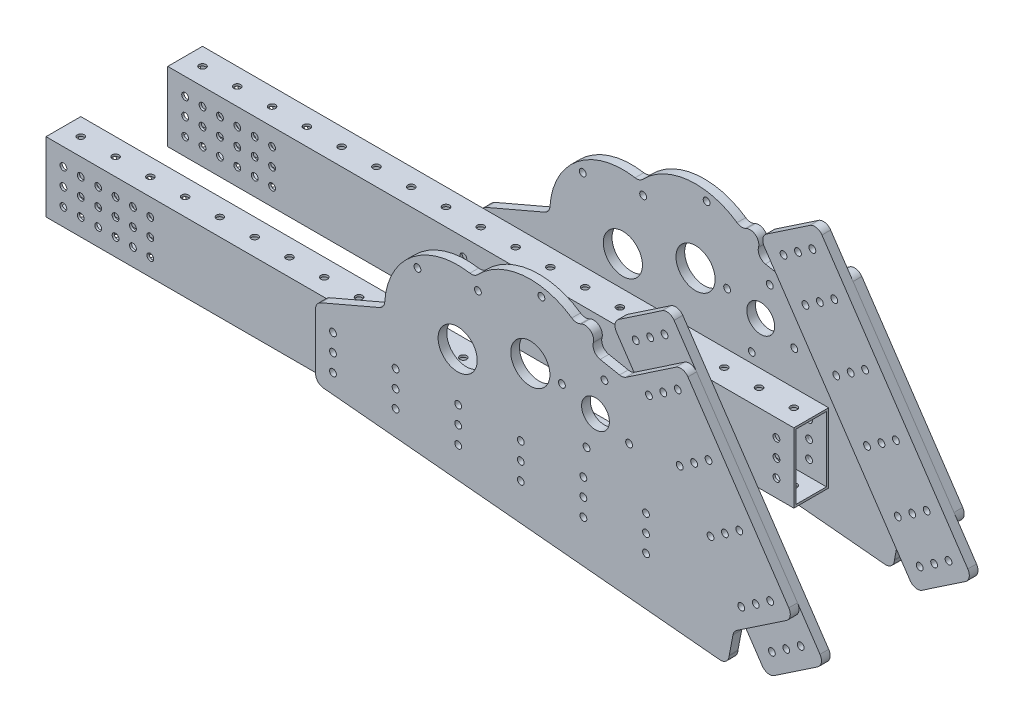
from build123d import *

# Parameters (mm, degrees)
BEARING_BLOCK_INTERFACE_PLATE_R = 2.4892
BOSS_EXTRUDE1_DEPTH             = 6.35
FILLET2_R                       = 6.35
PLATE_GB_R                      = 2.4892
PLATE_GB_R_2                    = 14.2875
PLATE_GB_R_3                    = 10.16
BOSS_EXTRUDE2_DEPTH             = 6.35
FILLET1_R                       = 6.35
TUBE_W                          = 457.2
TUBE_H                          = 50.8
BOSS_EXTRUDE3_DEPTH             = 25.4
SHELL2_T                        = -1.5875
SKETCH11_R                      = 2.4892
CUT_EXTRUDE4_DEPTH              = 696.020271071
TUBE_4_R                        = 2.4892
CUT_EXTRUDE2_DEPTH              = 773.869762832
SKETCH10_R                      = 2.4892
CUT_EXTRUDE3_DEPTH              = 774.104503156


with BuildPart() as part:
    # bearing block interface plate → Boss-Extrude1 (new body)
    with BuildSketch(Plane.XY.offset(57.15)):
        Polygon((529.051437766, 336.148394668), (571.166546451, 364.555394164), (684.794544436, 196.094959421), (642.679435751, 167.687959925), align=None)
        with Locations((646.106463048, 185.31848697)):
            Circle(BEARING_BLOCK_INTERFACE_PLATE_R, mode=Mode.SUBTRACT)
        with Locations((656.635240219, 192.420236844)):
            Circle(BEARING_BLOCK_INTERFACE_PLATE_R, mode=Mode.SUBTRACT)
        with Locations((667.164017391, 199.521986718)):
            Circle(BEARING_BLOCK_INTERFACE_PLATE_R, mode=Mode.SUBTRACT)
        with Locations((567.739519154, 346.924867119)):
            Circle(BEARING_BLOCK_INTERFACE_PLATE_R, mode=Mode.SUBTRACT)
        with Locations((557.210741982, 339.823117245)):
            Circle(BEARING_BLOCK_INTERFACE_PLATE_R, mode=Mode.SUBTRACT)
        with Locations((546.681964811, 332.721367371)):
            Circle(BEARING_BLOCK_INTERFACE_PLATE_R, mode=Mode.SUBTRACT)
        with Locations((562.660902028, 309.031618735)):
            Circle(BEARING_BLOCK_INTERFACE_PLATE_R, mode=Mode.SUBTRACT)
        with Locations((573.189679199, 316.133368609)):
            Circle(BEARING_BLOCK_INTERFACE_PLATE_R, mode=Mode.SUBTRACT)
        with Locations((583.71845637, 323.235118483)):
            Circle(BEARING_BLOCK_INTERFACE_PLATE_R, mode=Mode.SUBTRACT)
        with Locations((606.207330972, 289.893990773)):
            Circle(BEARING_BLOCK_INTERFACE_PLATE_R, mode=Mode.SUBTRACT)
        with Locations((595.6785538, 282.792240899)):
            Circle(BEARING_BLOCK_INTERFACE_PLATE_R, mode=Mode.SUBTRACT)
        with Locations((585.149776629, 275.690491025)):
            Circle(BEARING_BLOCK_INTERFACE_PLATE_R, mode=Mode.SUBTRACT)
        with Locations((628.696205573, 256.552863064)):
            Circle(BEARING_BLOCK_INTERFACE_PLATE_R, mode=Mode.SUBTRACT)
        with Locations((618.167428402, 249.45111319)):
            Circle(BEARING_BLOCK_INTERFACE_PLATE_R, mode=Mode.SUBTRACT)
        with Locations((607.63865123, 242.349363316)):
            Circle(BEARING_BLOCK_INTERFACE_PLATE_R, mode=Mode.SUBTRACT)
        with Locations((651.185080174, 223.211735354)):
            Circle(BEARING_BLOCK_INTERFACE_PLATE_R, mode=Mode.SUBTRACT)
        with Locations((640.656303003, 216.10998548)):
            Circle(BEARING_BLOCK_INTERFACE_PLATE_R, mode=Mode.SUBTRACT)
        with Locations((630.127525831, 209.008235606)):
            Circle(BEARING_BLOCK_INTERFACE_PLATE_R, mode=Mode.SUBTRACT)
    extrude(amount=-BOSS_EXTRUDE1_DEPTH)

    # Fillet2
    fillet2_edges = [part.edges().sort_by_distance(p)[0] for p in [
        (642.679435751, 167.687959925, 53.975),
        (571.166546451, 364.555394164, 53.975),
        (529.051437766, 336.148394668, 53.975),
        (684.794544436, 196.094959421, 53.975),
    ]]
    fillet(fillet2_edges, radius=FILLET2_R)


with BuildPart() as body_2:
    # plate+gb → Boss-Extrude2 (new body)
    with BuildSketch(Plane.XY.offset(63.5)):
        with BuildLine():
            Line((319.237342332, 246.126), (319.237342332, 195.326))
            Line((319.237342332, 195.326), (627.129512771, 166.477179286))
            ThreePointArc((627.129512771, 166.477179286), (622.555505171, 169.035259751), (621.371649855, 174.140532299))
            Line((621.371649855, 174.140532299), (623.889276442, 187.327918834))
            Line((623.889276442, 187.327918834), (624.075421765, 188.302952357))
            ThreePointArc((624.075421765, 188.302952357), (625.011743382, 190.608109349), (626.761896857, 192.376557749))
            Line((626.761896857, 192.376557749), (668.371747852, 220.44275663))
            Line((668.371747852, 220.44275663), (587.589343035, 340.207596955))
            Line((587.589343035, 340.207596955), (545.979492039, 312.141398074))
            ThreePointArc((545.979492039, 312.141398074), (543.684196204, 311.18115646), (541.196139608, 311.176541181))
            Line((541.196139608, 311.176541181), (540.222373002, 311.36920423))
            Line((540.222373002, 311.36920423), (527.052121603, 313.974983453))
            ThreePointArc((527.052121603, 313.974983453), (522.79804256, 316.926147758), (522.065562756, 322.05157775))
            ThreePointArc((522.065562756, 322.05157775), (520.117459336, 328.526714762), (513.437327672, 329.574735381))
            Line((513.437327672, 329.574735381), (509.130838224, 327.724214652))
            ThreePointArc((509.130838224, 327.724214652), (470.697933856, 338.939139441), (435.288517283, 320.256637088))
            ThreePointArc((435.288517283, 320.256637088), (389.695116812, 310.014081601), (369.664819812, 267.794947177))
            Line((369.664819812, 267.794947177), (319.237342332, 246.126))
        make_face()
        with Locations((630.127525831, 209.008235606)):
            Circle(PLATE_GB_R, mode=Mode.SUBTRACT)
        with Locations((517.084105797, 253.341484012)):
            Circle(PLATE_GB_R, mode=Mode.SUBTRACT)
        with Locations((640.656303003, 216.10998548)):
            Circle(PLATE_GB_R, mode=Mode.SUBTRACT)
        with Locations((651.185080174, 223.211735354)):
            Circle(PLATE_GB_R, mode=Mode.SUBTRACT)
        with Locations((607.63865123, 242.349363316)):
            Circle(PLATE_GB_R, mode=Mode.SUBTRACT)
        with Locations((618.167428402, 249.45111319)):
            Circle(PLATE_GB_R, mode=Mode.SUBTRACT)
        with Locations((423.001921395, 268.351)):
            Circle(PLATE_GB_R_2, mode=Mode.SUBTRACT)
        with Locations((476.064764939, 285.869819452)):
            Circle(PLATE_GB_R_2, mode=Mode.SUBTRACT)
        with Locations((393.660212596, 305.054190934)):
            Circle(PLATE_GB_R, mode=Mode.SUBTRACT)
        with Locations((437.784787317, 312.695671772)):
            Circle(PLATE_GB_R, mode=Mode.SUBTRACT)
        with Locations((484.156986664, 332.157788165)):
            Circle(PLATE_GB_R, mode=Mode.SUBTRACT)
        with Locations((548.192625531, 271.301996254)):
            Circle(PLATE_GB_R, mode=Mode.SUBTRACT)
        with Locations((499.123593555, 284.450003746)):
            Circle(PLATE_GB_R, mode=Mode.SUBTRACT)
        with Locations((523.658109543, 277.876)):
            Circle(PLATE_GB_R_3, mode=Mode.SUBTRACT)
        with Locations((628.696205573, 256.552863064)):
            Circle(PLATE_GB_R, mode=Mode.SUBTRACT)
        with Locations((585.149776629, 275.690491025)):
            Circle(PLATE_GB_R, mode=Mode.SUBTRACT)
        with Locations((595.6785538, 282.792240899)):
            Circle(PLATE_GB_R, mode=Mode.SUBTRACT)
        with Locations((606.207330972, 289.893990773)):
            Circle(PLATE_GB_R, mode=Mode.SUBTRACT)
        with Locations((530.232113289, 302.410515988)):
            Circle(PLATE_GB_R, mode=Mode.SUBTRACT)
        with Locations((562.660902028, 309.031618735)):
            Circle(PLATE_GB_R, mode=Mode.SUBTRACT)
        with Locations((573.189679199, 316.133368609)):
            Circle(PLATE_GB_R, mode=Mode.SUBTRACT)
        with Locations((583.71845637, 323.235118483)):
            Circle(PLATE_GB_R, mode=Mode.SUBTRACT)
    extrude(amount=-BOSS_EXTRUDE2_DEPTH)

    # Fillet1
    fillet1_edges = [body_2.edges().sort_by_distance(p)[0] for p in [
        (668.371747852, 220.44275663, 60.325),
        (587.589343035, 340.207596955, 60.325),
        (319.237342332, 195.326, 60.325),
        (627.129512771, 166.477179286, 60.325),
        (435.288517283, 320.256637088, 60.325),
        (369.664819812, 267.794947177, 60.325),
        (509.130838224, 327.724214652, 60.325),
        (319.237342332, 246.126, 60.325),
    ]]
    fillet(fillet1_edges, radius=FILLET1_R)

    # Sketch10 → Cut-Extrude3 (cut, through all)
    with BuildSketch(Plane.XY.offset(63.5)):
        with Locations((469.097342332, 208.026)):
            Circle(SKETCH10_R)
        with Locations((423.377342332, 208.026)):
            Circle(SKETCH10_R)
        with Locations((377.657342332, 208.026)):
            Circle(SKETCH10_R)
        with Locations((331.937342332, 208.026)):
            Circle(SKETCH10_R)
        with Locations((331.937342332, 220.726)):
            Circle(SKETCH10_R)
        with Locations((377.657342332, 220.726)):
            Circle(SKETCH10_R)
        with Locations((423.377342332, 220.726)):
            Circle(SKETCH10_R)
        with Locations((469.097342332, 220.726)):
            Circle(SKETCH10_R)
        with Locations((514.817342332, 220.726)):
            Circle(SKETCH10_R)
        with Locations((514.817342332, 208.026)):
            Circle(SKETCH10_R)
        with Locations((560.537342332, 208.026)):
            Circle(SKETCH10_R)
        with Locations((560.537342332, 220.726)):
            Circle(SKETCH10_R)
        with Locations((560.537342332, 233.426)):
            Circle(SKETCH10_R)
        with Locations((514.817342332, 233.426)):
            Circle(SKETCH10_R)
        with Locations((469.097342332, 233.426)):
            Circle(SKETCH10_R)
        with Locations((423.377342332, 233.426)):
            Circle(SKETCH10_R)
        with Locations((377.657342332, 233.426)):
            Circle(SKETCH10_R)
        with Locations((331.937342332, 233.426)):
            Circle(SKETCH10_R)
    extrude(amount=-CUT_EXTRUDE3_DEPTH, mode=Mode.SUBTRACT)


with BuildPart() as body_3:
    # tube → Boss-Extrude3 (new body)
    with BuildSketch(Plane.XY.offset(57.15)):
        with Locations((344.637342332, 220.726)):
            Rectangle(TUBE_W, TUBE_H)
    extrude(amount=-BOSS_EXTRUDE3_DEPTH)

    # Shell2
    shell2_openings = [body_3.faces().sort_by_distance(p)[0] for p in [
        (573.237342332, 220.726, 44.45),
        (116.037342332, 220.726, 44.45),
    ]]
    offset(amount=SHELL2_T, openings=shell2_openings, kind=Kind.INTERSECTION)

    # Sketch11 → Cut-Extrude4 (cut, through all)
    with BuildSketch(Plane(origin=(0, 246.126, 0), x_dir=(1, 0, 0), z_dir=(0, 1, 0))):
        with Locations((560.537342332, -44.45)):
            Circle(SKETCH11_R)
        with Locations((535.137342332, -44.45)):
            Circle(SKETCH11_R)
        with Locations((509.737342332, -44.45)):
            Circle(SKETCH11_R)
        with Locations((484.337342332, -44.45)):
            Circle(SKETCH11_R)
        with Locations((458.937342332, -44.45)):
            Circle(SKETCH11_R)
        with Locations((433.537342332, -44.45)):
            Circle(SKETCH11_R)
        with Locations((408.137342332, -44.45)):
            Circle(SKETCH11_R)
        with Locations((382.737342332, -44.45)):
            Circle(SKETCH11_R)
        with Locations((357.337342332, -44.45)):
            Circle(SKETCH11_R)
        with Locations((331.937342332, -44.45)):
            Circle(SKETCH11_R)
        with Locations((306.537342332, -44.45)):
            Circle(SKETCH11_R)
        with Locations((281.137342332, -44.45)):
            Circle(SKETCH11_R)
        with Locations((255.737342332, -44.45)):
            Circle(SKETCH11_R)
        with Locations((230.337342332, -44.45)):
            Circle(SKETCH11_R)
        with Locations((204.937342332, -44.45)):
            Circle(SKETCH11_R)
        with Locations((179.537342332, -44.45)):
            Circle(SKETCH11_R)
        with Locations((154.137342332, -44.45)):
            Circle(SKETCH11_R)
        with Locations((128.737342332, -44.45)):
            Circle(SKETCH11_R)
    extrude(amount=-CUT_EXTRUDE4_DEPTH, mode=Mode.SUBTRACT)

    # tube<4> → Cut-Extrude2 (cut, through all)
    with BuildSketch(Plane.XY.offset(57.15)):
        with Locations((560.537342332, 220.726)):
            Circle(TUBE_4_R)
        with Locations((560.537342332, 208.026)):
            Circle(TUBE_4_R)
        with Locations((560.537342332, 233.426)):
            Circle(TUBE_4_R)
        with Locations((514.817342332, 208.026)):
            Circle(TUBE_4_R)
        with Locations((514.817342332, 220.726)):
            Circle(TUBE_4_R)
        with Locations((514.817342332, 233.426)):
            Circle(TUBE_4_R)
        with Locations((469.097342332, 208.026)):
            Circle(TUBE_4_R)
        with Locations((469.097342332, 220.726)):
            Circle(TUBE_4_R)
        with Locations((469.097342332, 233.426)):
            Circle(TUBE_4_R)
        with Locations((423.377342332, 208.026)):
            Circle(TUBE_4_R)
        with Locations((423.377342332, 220.726)):
            Circle(TUBE_4_R)
        with Locations((423.377342332, 233.426)):
            Circle(TUBE_4_R)
        with Locations((377.657342332, 208.026)):
            Circle(TUBE_4_R)
        with Locations((377.657342332, 220.726)):
            Circle(TUBE_4_R)
        with Locations((377.657342332, 233.426)):
            Circle(TUBE_4_R)
        with Locations((331.937342332, 208.026)):
            Circle(TUBE_4_R)
        with Locations((331.937342332, 220.726)):
            Circle(TUBE_4_R)
        with Locations((331.937342332, 233.426)):
            Circle(TUBE_4_R)
        with Locations((128.737342332, 220.726)):
            Circle(TUBE_4_R)
        with Locations((128.737342332, 208.026)):
            Circle(TUBE_4_R)
        with Locations((128.737342332, 233.426)):
            Circle(TUBE_4_R)
        with Locations((141.437342332, 220.726)):
            Circle(TUBE_4_R)
        with Locations((141.437342332, 208.026)):
            Circle(TUBE_4_R)
        with Locations((141.437342332, 233.426)):
            Circle(TUBE_4_R)
        with Locations((154.137342332, 220.726)):
            Circle(TUBE_4_R)
        with Locations((154.137342332, 208.026)):
            Circle(TUBE_4_R)
        with Locations((154.137342332, 233.426)):
            Circle(TUBE_4_R)
        with Locations((166.837342332, 220.726)):
            Circle(TUBE_4_R)
        with Locations((166.837342332, 208.026)):
            Circle(TUBE_4_R)
        with Locations((166.837342332, 233.426)):
            Circle(TUBE_4_R)
        with Locations((179.537342332, 220.726)):
            Circle(TUBE_4_R)
        with Locations((179.537342332, 208.026)):
            Circle(TUBE_4_R)
        with Locations((179.537342332, 233.426)):
            Circle(TUBE_4_R)
        with Locations((192.237342332, 220.726)):
            Circle(TUBE_4_R)
        with Locations((192.237342332, 208.026)):
            Circle(TUBE_4_R)
        with Locations((192.237342332, 233.426)):
            Circle(TUBE_4_R)
    extrude(amount=-CUT_EXTRUDE2_DEPTH, mode=Mode.SUBTRACT)


with BuildPart() as body_4:
    # Mirror1: mirrored copy
    add(body_2.part.mirror(Plane.XY))


with BuildPart() as body_5:
    # Mirror1 2: mirrored copy
    add(body_3.part.mirror(Plane.XY))


with BuildPart() as body_6:
    # Mirror1 3: mirrored copy
    add(part.part.mirror(Plane.XY))


solid = Compound([part.part, body_2.part, body_3.part, body_4.part, body_5.part, body_6.part])
